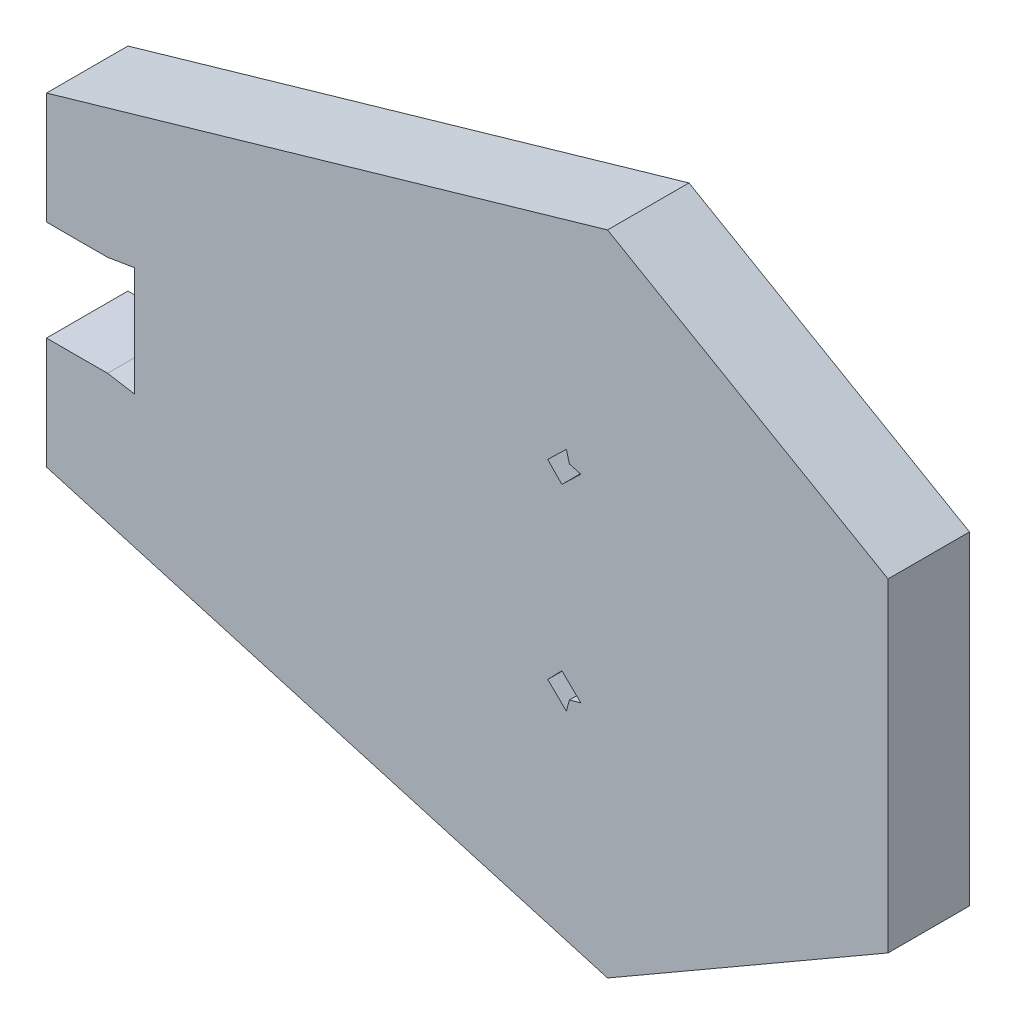
from build123d import *

# Parameters (mm, degrees)
BOSS_EXTRUDE1_DEPTH = 6


with BuildPart() as part:
    # Sketch1 → Boss-Extrude1 (new body)
    with BuildSketch(Plane.XY):
        Polygon((25.85, 11.931905563), (5.183333333, 23.863811127), (-36.15, 11.931905563), (-36.15, 3.7), (-31.65, 3.7), (-29.65, 4.032414656), (-29.65, -4.032414656), (-31.65, -3.7), (-36.15, -3.7), (-36.15, -11.931905563), (5.183333333, -23.863811127), (25.85, -11.931905563), align=None)
        Polygon((2.151041602, 8.352258132), (2.375323986, 7.525323986), (3.217094043, 7.297017783), (1.820276473, 5.94286277), (0.776412356, 7.019613751), align=None, mode=Mode.SUBTRACT)
        Polygon((2.151041602, -8.352258132), (0.776412356, -7.019613751), (1.820276473, -5.94286277), (3.217094043, -7.297017783), (2.375323986, -7.525323986), align=None, mode=Mode.SUBTRACT)
    extrude(amount=BOSS_EXTRUDE1_DEPTH)


solid = part.part
